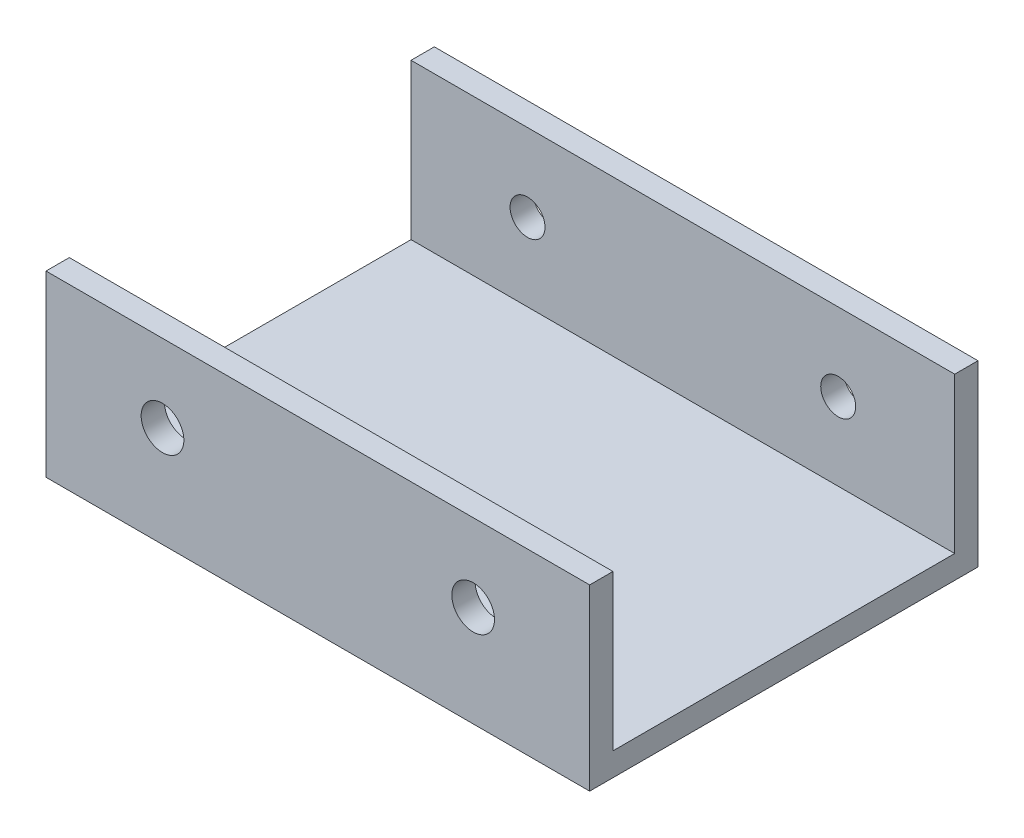
from build123d import *

# Parameters (mm, degrees)
SKETCH1_W           = 70
SKETCH1_H           = 20
SKETCH1_R           = 2.25
BOSS_EXTRUDE1_DEPTH = 3
SKETCH2_W           = 70
SKETCH2_H           = 50
BOSS_EXTRUDE2_DEPTH = 3
SKETCH3_W           = 70
SKETCH3_H           = 20
SKETCH3_R           = 2.75
BOSS_EXTRUDE3_DEPTH = 3


with BuildPart() as part:
    # Sketch1 → Boss-Extrude1 (new body)
    with BuildSketch(Plane.XY):
        with Locations((35, 10)):
            Rectangle(SKETCH1_W, SKETCH1_H)
        with Locations((15, 10)):
            Circle(SKETCH1_R, mode=Mode.SUBTRACT)
        with Locations((55, 10)):
            Circle(SKETCH1_R, mode=Mode.SUBTRACT)
    extrude(amount=BOSS_EXTRUDE1_DEPTH)

    # Sketch2 → Boss-Extrude2 (add)
    with BuildSketch(Plane.XZ):
        with Locations((35, 25)):
            Rectangle(SKETCH2_W, SKETCH2_H)
    extrude(amount=BOSS_EXTRUDE2_DEPTH)

    # Sketch3 → Boss-Extrude3 (add)
    with BuildSketch(Plane.XY.offset(50)):
        with Locations((35, 10)):
            Rectangle(SKETCH3_W, SKETCH3_H)
        with Locations((15, 10)):
            Circle(SKETCH3_R, mode=Mode.SUBTRACT)
        with Locations((55, 10)):
            Circle(SKETCH3_R, mode=Mode.SUBTRACT)
    extrude(amount=-BOSS_EXTRUDE3_DEPTH)


solid = part.part
